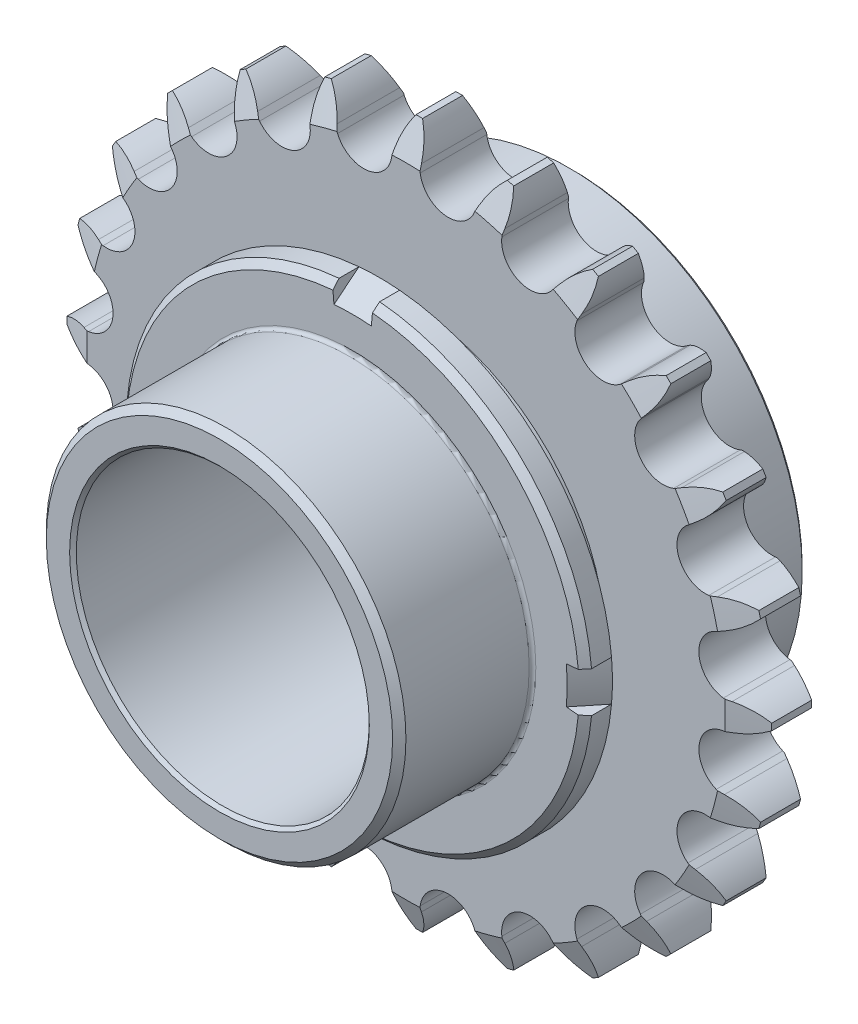
from build123d import *

# Parameters (mm, degrees)
SKETCH2_R                       = 44.394239605
BOSS_EXTRUDE1_DEPTH             = 5
BOSS_EXTRUDE2_REACH             = 64.982
BOSS_EXTRUDE2_DIRECTION_2_REACH = 64.982
CIRPATTERN1_COUNT               = 24
BOSS_EXTRUDE3_DEPTH             = 13
BOSS_EXTRUDE3_DEPTH_BACK        = 20
SKETCH6_R                       = 35
CUT_EXTRUDE1_DEPTH              = 78.467406177
CUT_EXTRUDE1_DEPTH_BACK         = 78.467406177
SKETCH7_R                       = 22
SKETCH9_R                       = 27
SKETCH9_R_2                     = 22
BOSS_EXTRUDE4_DEPTH             = 20
CHAMFER1_SIZE                   = 1
SKETCH10_W                      = 4
SKETCH10_H                      = 10
CUT_REVOLVE9_ANGLE              = 10
CIRPATTERN2_COUNT               = 4
CHAMFER2_SIZE                   = 0.5
FILLET2_R                       = 0.5


with BuildPart() as part:
    # Sketch2 → Boss-Extrude1 (new, symmetric)
    with BuildSketch(Plane.XY):
        Circle(SKETCH2_R)
    extrude(amount=BOSS_EXTRUDE1_DEPTH, both=True)

    # Boss-Extrude2: up to this face of the body (flat: up to its plane)
    boss_extrude2_end = Plane(part.part.faces().sort_by_distance((0, 0, 5))[0])
    # Sketch4 → Boss-Extrude2 (add, up to the picked face)
    with BuildSketch(Plane.XY, mode=Mode.PRIVATE) as boss_extrude2_sk1:
        with BuildLine():
            Line((-0.5, 52.920690654), (0.5, 52.920690654))
            ThreePointArc((0.5, 52.920690654), (1.505944858, 50.872327694), (2.021304171, 48.649239605))
            Line((2.021304171, 48.649239605), (2.13523978, 47.649239605))
            ThreePointArc((2.13523978, 47.649239605), (3.351413419, 45.214180634), (5.794611052, 44.014440731))
            ThreePointArc((5.794611052, 44.014440731), (0, 44.394239605), (-5.794611052, 44.014440731))
            ThreePointArc((-5.794611052, 44.014440731), (-3.351413419, 45.214180634), (-2.13523978, 47.649239605))
            Line((-2.13523978, 47.649239605), (-2.021304171, 48.649239605))
            ThreePointArc((-2.021304171, 48.649239605), (-1.505944858, 50.872327694), (-0.5, 52.920690654))
        make_face()
    boss_extrude2_tool1 = split(extrude(boss_extrude2_sk1.sketch, amount=BOSS_EXTRUDE2_REACH, mode=Mode.PRIVATE), bisect_by=boss_extrude2_end, keep=Keep.BOTH, mode=Mode.PRIVATE)
    boss_extrude2 = boss_extrude2_tool1.solids().sort_by(Axis((0, 47.611932, 0), (0, 0, 1)))[0]
    add(boss_extrude2)

    # Boss-Extrude2 direction 2: up to this face of the body (flat: up to its plane)
    boss_extrude2_direction_2_end = Plane(part.part.faces().sort_by_distance((0, 0, -5))[0])
    # Sketch4 → Boss-Extrude2 direction 2 (add, up to the picked face)
    with BuildSketch(Plane.XY, mode=Mode.PRIVATE) as boss_extrude2_direction_2_sk1:
        with BuildLine():
            Line((-0.5, 52.920690654), (0.5, 52.920690654))
            ThreePointArc((0.5, 52.920690654), (1.505944858, 50.872327694), (2.021304171, 48.649239605))
            Line((2.021304171, 48.649239605), (2.13523978, 47.649239605))
            ThreePointArc((2.13523978, 47.649239605), (3.351413419, 45.214180634), (5.794611052, 44.014440731))
            ThreePointArc((5.794611052, 44.014440731), (0, 44.394239605), (-5.794611052, 44.014440731))
            ThreePointArc((-5.794611052, 44.014440731), (-3.351413419, 45.214180634), (-2.13523978, 47.649239605))
            Line((-2.13523978, 47.649239605), (-2.021304171, 48.649239605))
            ThreePointArc((-2.021304171, 48.649239605), (-1.505944858, 50.872327694), (-0.5, 52.920690654))
        make_face()
    boss_extrude2_direction_2_tool1 = split(extrude(boss_extrude2_direction_2_sk1.sketch, amount=-BOSS_EXTRUDE2_DIRECTION_2_REACH, mode=Mode.PRIVATE), bisect_by=boss_extrude2_direction_2_end, keep=Keep.BOTH, mode=Mode.PRIVATE)
    boss_extrude2_direction_2 = boss_extrude2_direction_2_tool1.solids().sort_by(Axis((0, 47.611932, 0), (0, 0, -1)))[0]
    add(boss_extrude2_direction_2)

    # CirPattern1: Boss-Extrude2, Boss-Extrude2 direction 2 ×24 about axis
    cirpattern1_axis = Axis((0, 0, 5), (0, 0, -1))
    add([boss_extrude2.rotate(cirpattern1_axis, i * 360 / CIRPATTERN1_COUNT) for i in range(1, CIRPATTERN1_COUNT)])
    add([boss_extrude2_direction_2.rotate(cirpattern1_axis, i * 360 / CIRPATTERN1_COUNT) for i in range(1, CIRPATTERN1_COUNT)])

    # Sketch5 → Cut-Revolve7 (revolve, cut)
    with BuildSketch(Plane(origin=(0, 0, 0), x_dir=(0, 0, -1), z_dir=(1, 0, 0))):
        Polygon((6, 60.420690654), (0, 60.420690654), (6, 45.420690654), align=None)
        Polygon((0, 60.420690654), (-6, 60.420690654), (-6, 45.420690654), align=None)
    revolve(axis=Axis((0, 0, 0), (0, 0, 1)), mode=Mode.SUBTRACT)

    # Sketch6 → Boss-Extrude3 (add, two sides: drawn at the far end of the back side and taken through both)
    with BuildSketch(Plane.XY.offset(-BOSS_EXTRUDE3_DEPTH_BACK)):
        Circle(SKETCH6_R)
    extrude(amount=BOSS_EXTRUDE3_DEPTH + BOSS_EXTRUDE3_DEPTH_BACK)

    # Sketch7 → Cut-Extrude1 (cut, two sides: drawn at the far end of the back side and taken through both)
    with BuildSketch(Plane.XY.offset(-CUT_EXTRUDE1_DEPTH_BACK)):
        Circle(SKETCH7_R)
    extrude(amount=CUT_EXTRUDE1_DEPTH + CUT_EXTRUDE1_DEPTH_BACK, mode=Mode.SUBTRACT)

    # Sketch9 → Boss-Extrude4 (add)
    with BuildSketch(Plane.XY.offset(13)):
        Circle(SKETCH9_R)
        Circle(SKETCH9_R_2, mode=Mode.SUBTRACT)
    extrude(amount=BOSS_EXTRUDE4_DEPTH)

    # Chamfer1
    chamfer1_edges = [part.edges().sort_by_distance(p)[0] for p in [
        (-27, 0, 33),
        (-35, 0, 5),
        (-35, 0, 13),
    ]]
    chamfer(chamfer1_edges, length=CHAMFER1_SIZE)

    # Sketch10 → Cut-Revolve8 (revolve, cut)
    with BuildSketch(Plane(origin=(0, 0, 0), x_dir=(0, 0, -1), z_dir=(1, 0, 0))):
        with Locations((-7, 35)):
            Rectangle(SKETCH10_W, SKETCH10_H)
    revolve(axis=Axis((0, 0, -20), (0, 0, 1)), mode=Mode.SUBTRACT)

    # Sketch11 → Cut-Revolve9 (revolve, symmetric, cut)
    with BuildSketch(Plane(origin=(0, 0, 0), x_dir=(0, 0, -1), z_dir=(1, 0, 0))) as cut_revolve9_sk:
        Polygon((-9, 35), (-13, 32.199169847), (-13, 35), align=None)
    cut_revolve9 = revolve(axis=Axis((0, 0, -20), (0, 0, 1)), revolution_arc=CUT_REVOLVE9_ANGLE / 2, mode=Mode.SUBTRACT)
    cut_revolve9 = cut_revolve9 + revolve(cut_revolve9_sk.sketch, axis=Axis((0, 0, -20), (0, 0, -1)), revolution_arc=CUT_REVOLVE9_ANGLE / 2, mode=Mode.SUBTRACT)

    # CirPattern2: Cut-Revolve9 ×4 about axis
    cirpattern2_axis = Axis((0, 0, -20), (0, 0, 1))
    for i in range(1, CIRPATTERN2_COUNT):
        add(cut_revolve9.rotate(cirpattern2_axis, i * 360 / CIRPATTERN2_COUNT), mode=Mode.SUBTRACT)

    # Chamfer2
    chamfer2_edges = [part.edges().sort_by_distance(p)[0] for p in [
        (-22, 0, 33),
        (-35, 0, -20),
        (-22, 0, -20),
    ]]
    chamfer(chamfer2_edges, length=CHAMFER2_SIZE)

    # Fillet2
    fillet2_edges = [part.edges().sort_by_distance(p)[0] for p in [
        (-35, 0, -5),
        (-27, 0, 13),
    ]]
    fillet(fillet2_edges, radius=FILLET2_R)


solid = part.part
